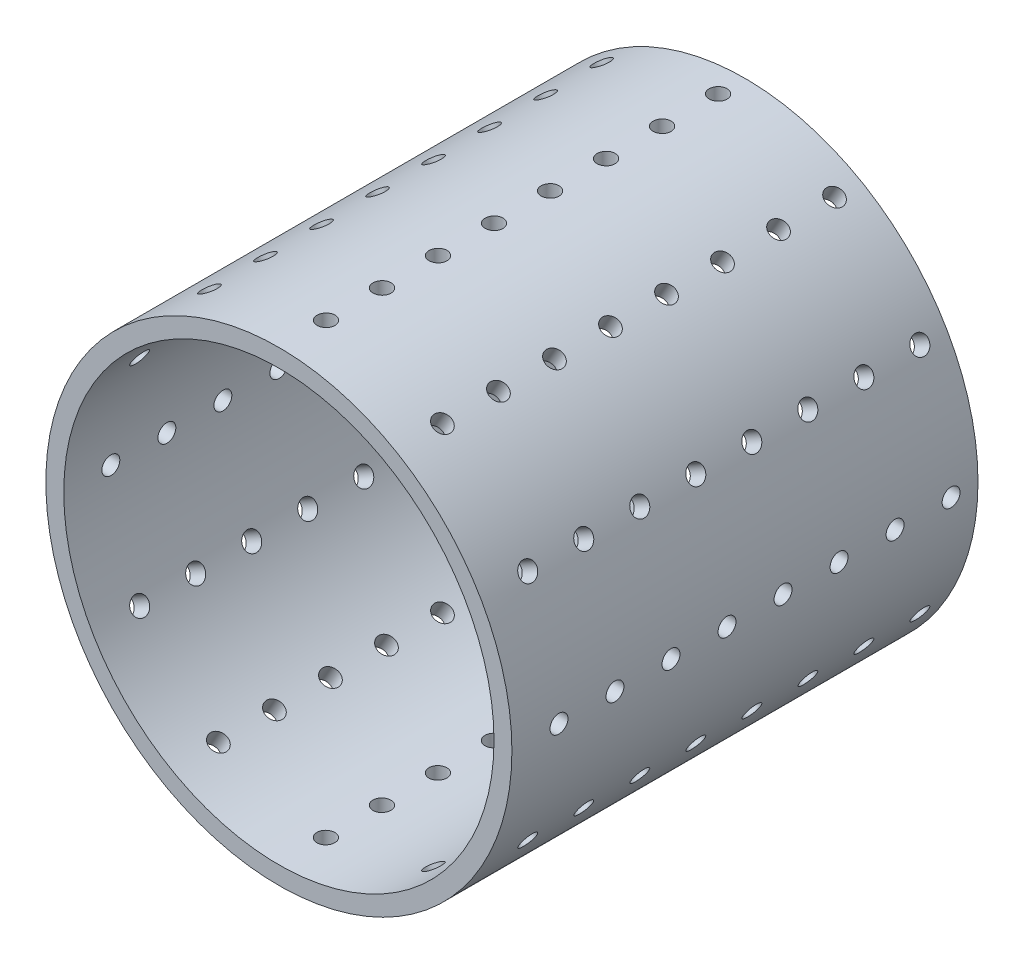
from build123d import *

# Parameters (mm, degrees)
SKETCH1_R           = 41.275
SKETCH1_R_2         = 38.1
BOSS_EXTRUDE1_DEPTH = 82.55
SKETCH2_R           = 1.5875
CUT_EXTRUDE2_DEPTH  = 44.45
CIRPATTERN1_COUNT   = 12


with BuildPart() as part:
    # Sketch1 → Boss-Extrude1 (new body)
    with BuildSketch(Plane.XY):
        Circle(SKETCH1_R)
        Circle(SKETCH1_R_2, mode=Mode.SUBTRACT)
    extrude(amount=BOSS_EXTRUDE1_DEPTH)

    # Sketch2 → Cut-Extrude2 (cut, symmetric)
    with BuildSketch(Plane(origin=(0, 0, 0), x_dir=(1, 0, 0), z_dir=(0, 1, 0))):
        with Locations(Location((0, -44.45, 0), (0, 0, 270))):
            Circle(SKETCH2_R)
        with Locations(Location((0, -4.7625, 0), (0, 0, 270))):
            Circle(SKETCH2_R)
        with Locations((0, -84.1375)):
            Circle(SKETCH2_R)
        with Locations(Location((0, -24.60625, 0), (0, 0, 270))):
            Circle(SKETCH2_R)
        with Locations(Location((0, -64.29375, 0), (0, 0, 270))):
            Circle(SKETCH2_R)
        with Locations(Location((0, -14.684375, 0), (0, 0, 270))):
            Circle(SKETCH2_R)
        with Locations(Location((0, -34.528125, 0), (0, 0, 270))):
            Circle(SKETCH2_R)
        with Locations(Location((0, -54.371875, 0), (0, 0, 270))):
            Circle(SKETCH2_R)
        with Locations(Location((0, -74.215625, 0), (0, 0, 270))):
            Circle(SKETCH2_R)
    cut_extrude2 = extrude(amount=CUT_EXTRUDE2_DEPTH, both=True, mode=Mode.SUBTRACT)

    # CirPattern1: Cut-Extrude2 ×12 about axis
    cirpattern1_axis = Axis((0, 0, 82.55), (0, 0, -1))
    for i in range(1, CIRPATTERN1_COUNT):
        add(cut_extrude2.rotate(cirpattern1_axis, i * 360 / CIRPATTERN1_COUNT), mode=Mode.SUBTRACT)


solid = part.part
